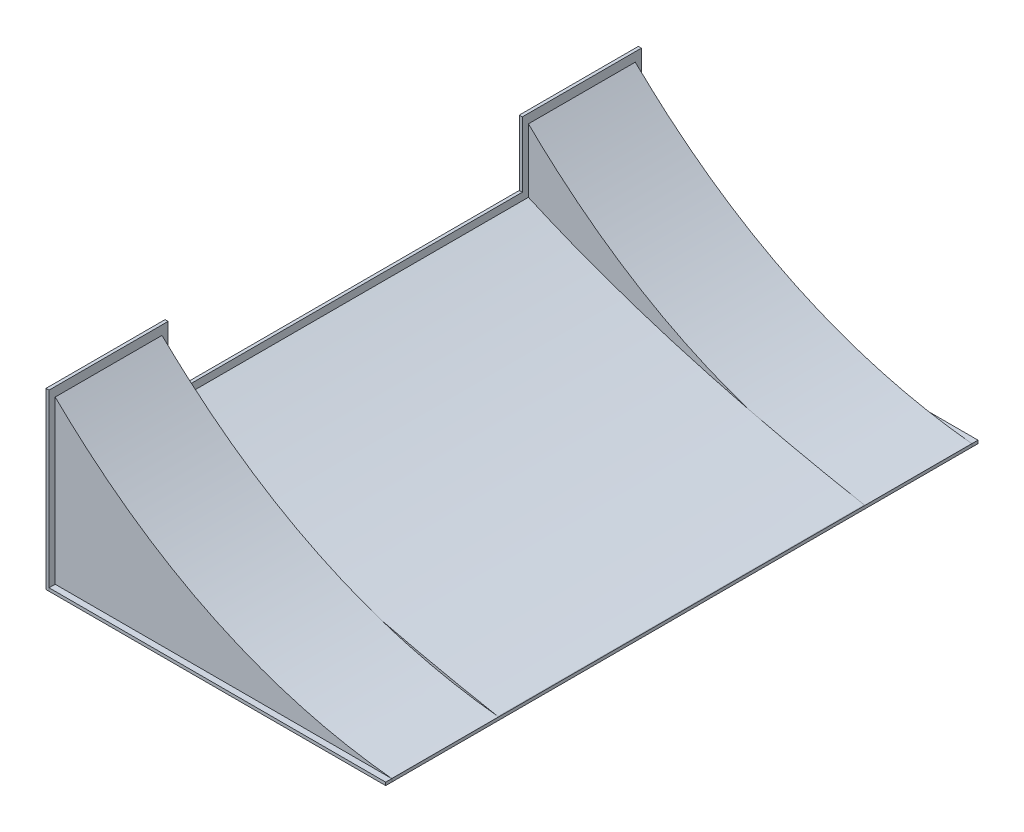
from build123d import *

# Parameters (mm, degrees)
BOSS_EXTRUDE2_DEPTH     = 2.5
EXTRUDE_THIN3_DEPTH     = 235
SKETCH4_W               = 1042.927071657
SKETCH4_H               = 5
BOSS_EXTRUDE3_DEPTH     = 7.5
EXTRUDE_THIN11_START    = -300
EXTRUDE_THIN11_DEPTH    = 600
EXTRUDE_THIN12_DEPTH    = 175
CUT_EXTRUDE1_DEPTH      = 1604.122683576
CUT_EXTRUDE1_DEPTH_BACK = 1604.122683576
SKETCH18_W              = 179.246865424
SKETCH18_H              = 302.92590826
EXTRUDE_THIN13_REACH    = 2495.065
SKETCH19_W              = 5
SKETCH19_H              = 275.339906304
EXTRUDE_THIN14_REACH    = 2495.065
SKETCH20_W              = 5
SKETCH20_H              = 275.339906304
EXTRUDE_THIN16_REACH    = 2495.065
SKETCH22_W              = 5
SKETCH22_H              = 168.458010872
FILLET1_R               = 20
SKETCH23_W              = 3.72541272
SKETCH23_H              = 6.292080427
SKETCH23_W_2            = 358.835343645
SKETCH23_H_2            = 131.046016594
CUT_EXTRUDE4_DEPTH      = 761
BOSS_EXTRUDE4_DEPTH     = 5
SKETCH27_W              = 715
SKETCH27_H              = 10
BOSS_EXTRUDE5_DEPTH     = 5
BOSS_EXTRUDE5_2_DEPTH   = 5
CUT_EXTRUDE5_DEPTH      = 1707.575053402
CUT_EXTRUDE5_DEPTH_BACK = 1707.575053402
SKETCH28_W              = 1486.694055837
SKETCH28_H              = 126.536927381


# Read off the part's stored shape, not the designer's step: Extrude-Thin11, Extrude-Thin12
with BuildPart() as part:
    # Sketch1 → Boss-Extrude2 (new, symmetric)
    with BuildSketch(Plane(origin=(0, 0, 0), x_dir=(1, 0, 0), z_dir=(0, 1, 0))):
        Polygon((480, 700), (-480, 700), (-480, 475), (-650, 475), (-650, -475), (-480, -475), (-480, -700), (480, -700), (480, -235), (827.5, -235), (827.5, 235), (480, 235), align=None)
    extrude(amount=BOSS_EXTRUDE2_DEPTH, both=True)

    # Sketch3 → Extrude-Thin3 (add, symmetric)
    with BuildSketch(Plane.XY):
        Polygon((1174.309655256, 102.402795067), (826.252385714, 2.402795067), (827.633075202, -2.402795067), (1175.690344744, 97.597204933), align=None)
    extrude(amount=EXTRUDE_THIN3_DEPTH, both=True)

    # Sketch4 → Boss-Extrude3 (add, symmetric)
    with BuildSketch(Plane(origin=(0, 0, 0), x_dir=(1, 0, 0), z_dir=(0, 1, 0))):
        with Locations((-8.495865184, 702.5)):
            Rectangle(SKETCH4_W, SKETCH4_H)
        with Locations((-8.495865184, -702.5)):
            Rectangle(SKETCH4_W, SKETCH4_H)
    extrude(amount=BOSS_EXTRUDE3_DEPTH, both=True)

    # Extrude-Thin11 outline → Extrude-Thin11 (add)
    with BuildSketch(Plane.XY.offset(EXTRUDE_THIN11_START)):
        with BuildLine():
            add(Edge.make_bspline(
                [(-650, -1.601095272), (-745.965421623, 16.551267125), (-841.722851264, 38.087184635), (-1031.435871365, 92.824431487), (-1125.339668468, 126.204489075), (-1216.040624187, 167.726874112)],
                knots=[0.007758763, 0.007758763, 0.007758763, 0.007758763, 0.5, 0.5, 1, 1, 1, 1], degree=3))
            Line((-650, -1.601095272), (-650, 2.5))
            Line((-650, 2.5), (-644.76696083, 2.5))
            add(Edge.make_bspline(
                [(-644.76696083, 2.5), (-742.06130715, 20.800439318), (-839.122513562, 42.540877144), (-1029.855355166, 97.572369595), (-1123.52387399, 130.872264144), (-1213.959375813, 172.273125888)],
                knots=[0.0003919, 0.0003919, 0.0003919, 0.0003919, 0.5, 0.5, 1, 1, 1, 1], degree=3))
            Line((-1213.959375813, 172.273125888), (-1216.040624187, 167.726874112))
        make_face()
    extrude(amount=EXTRUDE_THIN11_DEPTH)

    # Extrude-Thin12 outline → Extrude-Thin12 (add)
    with BuildSketch(Plane.XY.offset(300)):
        with BuildLine():
            add(Edge.make_bspline(
                [(-650, -1.887956912), (-714.399871829, 5.188072449), (-776.525735795, 18.708551477), (-836.365745858, 38.671512781)],
                knots=[0.008650658, 0.008650658, 0.008650658, 0.008650658, 0.307302261, 0.307302261, 0.307302261, 0.307302261], degree=3))
            Line((-650, -1.887956912), (-650, -1.601095272))
            add(Edge.make_bspline(
                [(-650, -1.601095272), (-712.340786915, 10.190991264), (-774.593800697, 23.410946466), (-836.365745858, 38.671512781)],
                knots=[0.007758763, 0.007758763, 0.007758763, 0.007758763, 0.327527129, 0.327527129, 0.327527129, 0.327527129], degree=3))
        make_face()
        with BuildLine():
            add(Edge.make_bspline(
                [(-836.365745858, 38.671512781), (-852.25304535, 43.971604553), (-867.979218957, 49.725815753), (-883.544044986, 55.934109562)],
                knots=[0.307302261, 0.307302261, 0.307302261, 0.307302261, 0.386593148, 0.386593148, 0.386593148, 0.386593148], degree=3))
            add(Edge.make_bspline(
                [(-650, -1.601095272), (-712.340786915, 10.190991264), (-774.593800697, 23.410946466), (-836.365745858, 38.671512781)],
                knots=[0.007758763, 0.007758763, 0.007758763, 0.007758763, 0.327527129, 0.327527129, 0.327527129, 0.327527129], degree=3))
            Line((-650, -1.601095272), (-650, 2.5))
            Line((-650, 2.5), (-644.76696083, 2.5))
            add(Edge.make_bspline(
                [(-644.76696083, 2.5), (-645.084729042, 2.559770152), (-645.402494767, 2.619576999), (-645.720257953, 2.679420622)],
                knots=[0.0003919, 0.0003919, 0.0003919, 0.0003919, 0.002023645, 0.002023645, 0.002023645, 0.002023645], degree=3))
            add(Edge.make_bspline(
                [(-645.720257953, 2.679420622), (-711.189774451, 9.609021002), (-774.276873408, 23.209547974), (-834.994147924, 43.483093002)],
                knots=[0.00285247, 0.00285247, 0.00285247, 0.00285247, 0.307654611, 0.307654611, 0.307654611, 0.307654611], degree=3))
            add(Edge.make_bspline(
                [(-834.994147924, 43.483093002), (-851.214231644, 47.489142042), (-867.399914765, 51.63578392), (-883.544044986, 55.934109562)],
                knots=[0.327229198, 0.327229198, 0.327229198, 0.327229198, 0.411337881, 0.411337881, 0.411337881, 0.411337881], degree=3))
        make_face()
        with BuildLine():
            add(Edge.make_bspline(
                [(-883.544044986, 55.934109562), (-905.805845785, 64.813604895), (-927.737585371, 74.621995841), (-1044.575495941, 132.698372544), (-1133.380170751, 198.087011734), (-1215.738171114, 281.482343019)],
                knots=[0.386593148, 0.386593148, 0.386593148, 0.386593148, 0.5, 0.5, 1, 1, 1, 1], degree=3))
            add(Edge.make_bspline(
                [(-834.994147924, 43.483093002), (-851.214231644, 47.489142042), (-867.399914765, 51.63578392), (-883.544044986, 55.934109562)],
                knots=[0.327229198, 0.327229198, 0.327229198, 0.327229198, 0.411337881, 0.411337881, 0.411337881, 0.411337881], degree=3))
            add(Edge.make_bspline(
                [(-834.994147924, 43.483093002), (-873.309783501, 56.276713423), (-910.681697892, 71.727690399), (-1041.816022387, 136.910355777), (-1130.167041169, 201.949150116), (-1212.180580511, 284.995681759)],
                knots=[0.307654611, 0.307654611, 0.307654611, 0.307654611, 0.5, 0.5, 1, 1, 1, 1], degree=3))
            Line((-1212.180580511, 284.995681759), (-1215.738171114, 281.482343019))
        make_face()
        with BuildLine():
            add(Edge.make_bspline(
                [(-644.76696083, 2.5), (-645.084729042, 2.559770152), (-645.402494767, 2.619576999), (-645.720257953, 2.679420622)],
                knots=[0.0003919, 0.0003919, 0.0003919, 0.0003919, 0.002023645, 0.002023645, 0.002023645, 0.002023645], degree=3))
            Line((-644.76696083, 2.5), (-644.010262456, 2.5))
            add(Edge.make_bspline(
                [(-644.010262456, 2.5), (-644.580441434, 2.559301539), (-645.15043993, 2.619108412), (-645.720257953, 2.679420622)],
                knots=[0.000199606, 0.000199606, 0.000199606, 0.000199606, 0.00285247, 0.00285247, 0.00285247, 0.00285247], degree=3))
        make_face()
    extrude(amount=EXTRUDE_THIN12_DEPTH)

    # Mirror2: part across plane


with BuildPart() as part_1:
    add(part.part)
    add(part.part.mirror(Plane.XY))

    # Sketch18 → Cut-Extrude1 (cut, two sides: drawn at the far end of the back side and taken through both)
    with BuildSketch(Plane.XY.offset(300).offset(-CUT_EXTRUDE1_DEPTH_BACK)):
        with Locations((-1289.623432712, 151.46295413)):
            Rectangle(SKETCH18_W, SKETCH18_H)
    extrude(amount=CUT_EXTRUDE1_DEPTH + CUT_EXTRUDE1_DEPTH_BACK, mode=Mode.SUBTRACT)

    # Sketch19 → Extrude-Thin13 (add, up to next)
    with BuildSketch(Plane(origin=(-1200, 0, 0), x_dir=(0, 0, -1), z_dir=(1, 0, 0)), mode=Mode.PRIVATE) as extrude_thin13_sk1:
        with Locations((472.5, 135.169953152)):
            Rectangle(SKETCH19_W, SKETCH19_H)
    extrude_thin13_tool1 = extrude(extrude_thin13_sk1.sketch, amount=EXTRUDE_THIN13_REACH, mode=Mode.PRIVATE) - part_1.part
    add(extrude_thin13_tool1.solids().sort_by_distance((-1200, 135.169953, -472.5))[0])

    # Sketch20 → Extrude-Thin14 (add, up to next)
    with BuildSketch(Plane(origin=(-1200, 0, 0), x_dir=(0, 0, -1), z_dir=(1, 0, 0)), mode=Mode.PRIVATE) as extrude_thin14_sk1:
        with Locations((302.5, 135.169953152)):
            Rectangle(SKETCH20_W, SKETCH20_H)
    extrude_thin14_tool1 = extrude(extrude_thin14_sk1.sketch, amount=EXTRUDE_THIN14_REACH, mode=Mode.PRIVATE) - part_1.part
    add(extrude_thin14_tool1.solids().sort_by_distance((-1200, 135.169953, -302.5))[0])

    # Sketch22 → Extrude-Thin16 (add, up to next)
    with BuildSketch(Plane(origin=(-1200, 0, 0), x_dir=(0, 0, -1), z_dir=(1, 0, 0)), mode=Mode.PRIVATE) as extrude_thin16_sk1:
        with Locations((197.5, 81.729005436)):
            Rectangle(SKETCH22_W, SKETCH22_H)
    extrude_thin16_tool1 = extrude(extrude_thin16_sk1.sketch, amount=EXTRUDE_THIN16_REACH, mode=Mode.PRIVATE) - part_1.part
    add(extrude_thin16_tool1.solids().sort_by_distance((-1200, 81.729005, -197.5))[0])

    # Mirror3: part across plane


with BuildPart() as part_2:
    add(part_1.part)
    add(part_1.part.mirror(Plane.XY))

    # Fillet1
    fillet1_edges = [part_2.edges().sort_by_distance(p)[0] for p in [
        (826.59071455, 2.5, 0),
    ]]
    fillet(fillet1_edges, radius=FILLET1_R)

    # Sketch23 → Cut-Extrude4 (cut, symmetric)
    with BuildSketch(Plane.XY):
        with Locations((825.63729364, 0.646040214)):
            Rectangle(SKETCH23_W, SKETCH23_H)
        with Locations((1006.917671822, 63.023008297)):
            Rectangle(SKETCH23_W_2, SKETCH23_H_2)
    extrude(amount=CUT_EXTRUDE4_DEPTH, both=True, mode=Mode.SUBTRACT)

    # Sketch25 → Boss-Extrude4 (add)
    with BuildSketch(Plane(origin=(-1200, 0, 0), x_dir=(0, 0, -1), z_dir=(1, 0, 0))):
        Polygon((485, -2.5), (470, -2.5), (470, 267.839906304), (305, 267.839906304), (305, 160.958010872), (-305, 160.958010872), (-305, 267.839906304), (-470, 267.839906304), (-470, -2.5), (-485, -2.5), (-485, 282.839906304), (-290, 282.839906304), (-290, 175.958010872), (290, 175.958010872), (290, 282.839906304), (485, 282.839906304), align=None)
    extrude(amount=BOSS_EXTRUDE4_DEPTH)


with BuildPart() as body_2:
    # Sketch27 → Boss-Extrude5 (new body)
    with BuildSketch(Plane(origin=(0, -2.5, 0), x_dir=(-1, 0, 0), z_dir=(0, -1, 0))):
        with Locations((837.5, 480)):
            Rectangle(SKETCH27_W, SKETCH27_H)
    extrude(amount=-BOSS_EXTRUDE5_DEPTH)


with BuildPart() as body_3:
    # Sketch27 → Boss-Extrude5 2 (new body)
    with BuildSketch(Plane(origin=(0, -2.5, 0), x_dir=(-1, 0, 0), z_dir=(0, -1, 0))):
        with Locations((837.5, -480)):
            Rectangle(SKETCH27_W, SKETCH27_H)
    extrude(amount=-BOSS_EXTRUDE5_2_DEPTH)


with BuildPart() as cut_extrude5_tool:
    # Sketch28 → Cut-Extrude5 (new, two sides: drawn at the far end of the back side and taken through both)
    with BuildSketch(Plane(origin=(0, 0, -475), x_dir=(-1, 0, 0), z_dir=(0, 0, -1)).offset(-CUT_EXTRUDE5_DEPTH_BACK)):
        with Locations((-99.598679398, 32.116598301)):
            Rectangle(SKETCH28_W, SKETCH28_H)
    extrude(amount=CUT_EXTRUDE5_DEPTH + CUT_EXTRUDE5_DEPTH_BACK)


with BuildPart() as part_3:
    add(part_2.part)

    # Cut-Extrude5: cut by cut_extrude5_tool
    add(cut_extrude5_tool.part, mode=Mode.SUBTRACT)


with BuildPart() as body_2_1:
    add(body_2.part)

    # Cut-Extrude5: cut by cut_extrude5_tool
    add(cut_extrude5_tool.part, mode=Mode.SUBTRACT)


with BuildPart() as body_3_1:
    add(body_3.part)

    # Cut-Extrude5: cut by cut_extrude5_tool
    add(cut_extrude5_tool.part, mode=Mode.SUBTRACT)


solid = Compound([part_3.part, body_2_1.part, body_3_1.part])
